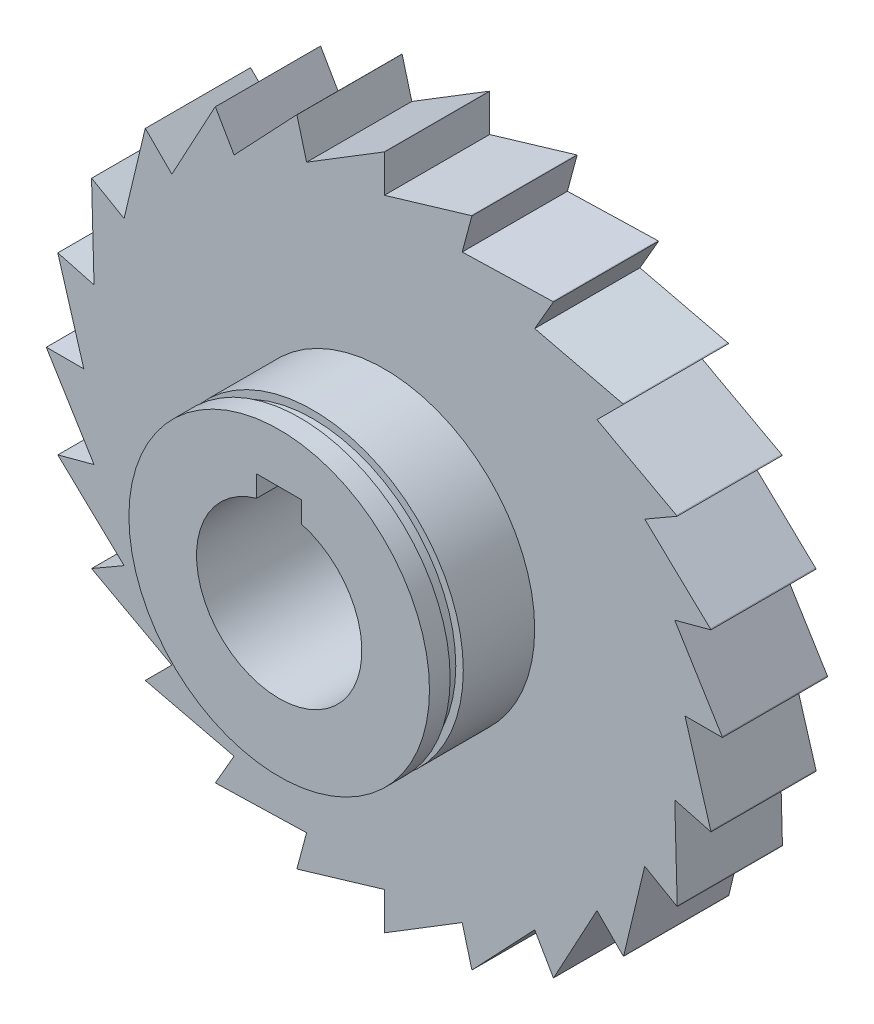
from build123d import *

# Parameters (mm, degrees)
SKETCH1_R                  = 45
BOSS_EXTRUDE1_DEPTH        = 14
SKETCH2_R                  = 20
BOSS_EXTRUDE2_DEPTH        = 14
CUT_EXTRUDE1_DEPTH         = 70.526973183
CUT_EXTRUDE1_DEPTH_BACK    = 70.526973183
SKETCH3_R                  = 11
CUT_EXTRUDE2_DEPTH         = 70.526973183
CUT_EXTRUDE2_DEPTH_BACK    = 6
SKETCH4_R                  = 30
CUT_EXTRUDE3_DEPTH         = 70.526973183
CUT_EXTRUDE3_DEPTH_BACK    = 70.526973183
SKETCH5_W                  = 6
SKETCH5_H                  = 4.8
CUT_EXTRUDE4_DEPTH         = 70.526973183
FILLET1_R                  = 0.4
CIRPATTERN1_DEPTH          = 14
CUT_J8_CIRCLIPGROOVE_START = 23.5
SKETCH_J8_GROOVE_R         = 21.5
SKETCH_J8_GROOVE_R_2       = 19
CUT_J8_CIRCLIPGROOVE_DEPTH = 1.75


# Read off the part's stored shape, not the designer's step: CirPattern1
with BuildPart() as part:
    # Sketch1 → Boss-Extrude1 (new body)
    with BuildSketch(Plane.XY):
        Circle(SKETCH1_R)
    extrude(amount=BOSS_EXTRUDE1_DEPTH)

    # Sketch2 → Boss-Extrude2 (add)
    with BuildSketch(Plane.XY.offset(14)):
        Circle(SKETCH2_R)
    extrude(amount=BOSS_EXTRUDE2_DEPTH)

    # Sketch3 → Cut-Extrude1 (cut, two sides: drawn at the far end of the back side and taken through both)
    with BuildSketch(Plane.XY.offset(28).offset(-CUT_EXTRUDE1_DEPTH_BACK)):
        Circle(SKETCH3_R)
    extrude(amount=CUT_EXTRUDE1_DEPTH + CUT_EXTRUDE1_DEPTH_BACK, mode=Mode.SUBTRACT)

    # Sketch4 → Cut-Extrude2 (cut, two sides: drawn at the far end of the back side and taken through both)
    with BuildSketch(Plane(origin=(0, 0, 0), x_dir=(-1, 0, 0), z_dir=(0, 0, -1)).offset(-CUT_EXTRUDE2_DEPTH_BACK)):
        Circle(SKETCH4_R)
    extrude(amount=CUT_EXTRUDE2_DEPTH + CUT_EXTRUDE2_DEPTH_BACK, mode=Mode.SUBTRACT)

    # Sketch5 → Cut-Extrude3 (cut, two sides: drawn at the far end of the back side and taken through both)
    with BuildSketch(Plane.XY.offset(28).offset(-CUT_EXTRUDE3_DEPTH_BACK)):
        with Locations((0, 11)):
            Rectangle(SKETCH5_W, SKETCH5_H)
    extrude(amount=CUT_EXTRUDE3_DEPTH + CUT_EXTRUDE3_DEPTH_BACK, mode=Mode.SUBTRACT)

    # Sketch6 → Cut-Extrude4 (cut, symmetric)
    with BuildSketch(Plane(origin=(0, 0, 0), x_dir=(-1, 0, 0), z_dir=(0, 0, -1))):
        with BuildLine():
            Line((0, 40), (0, 45))
            ThreePointArc((0, 45), (-5.87367865, 44.615018762), (-11.64685703, 43.466662183))
            Line((-11.64685703, 43.466662183), (0, 40))
        make_face()
    extrude(amount=CUT_EXTRUDE4_DEPTH, both=True, mode=Mode.SUBTRACT)

    # Fillet1
    fillet1_edges = [part.edges().sort_by_distance(p)[0] for p in [
        (11.64685703, 43.466662183, 7),
    ]]
    fillet(fillet1_edges, radius=FILLET1_R)

    # CirPattern1 outline → CirPattern1 (cut)
    with BuildSketch(Plane.XY):
        with BuildLine():
            Line((10.352761804, 38.637033052), (22.386673811, 38.96802613))
            ThreePointArc((22.386673811, 38.96802613), (22.43960565, 38.965973203), (22.491802074, 38.956943945))
            Line((22.491802074, 38.956943945), (20, 34.641016151))
            Line((20, 34.641016151), (31.709533711, 31.8461253))
            ThreePointArc((31.709533711, 31.8461253), (31.760130605, 31.830442556), (31.808211535, 31.808211535))
            Line((31.808211535, 31.808211535), (28.284271247, 28.284271247))
            Line((28.284271247, 28.284271247), (38.871441292, 22.553963659))
            ThreePointArc((38.871441292, 22.553963659), (38.916255145, 22.525719852), (38.956943945, 22.491802074))
            Line((38.956943945, 22.491802074), (34.641016151, 20))
            Line((34.641016151, 20), (43.384324386, 11.724786666))
            ThreePointArc((43.384324386, 11.724786666), (43.42030121, 11.685906565), (43.450825005, 11.642613471))
            Line((43.450825005, 11.642613471), (38.637033052, 10.352761804))
            Line((38.637033052, 10.352761804), (44.94063747, 0.096584839))
            ThreePointArc((44.94063747, 0.096584839), (44.965325502, 0.049718058), (44.983604147, 0))
            Line((44.983604147, 0), (40, 0))
            Line((40, 0), (43.434320378, -11.538199086))
            ThreePointArc((43.434320378, -11.538199086), (43.44603717, -11.589858654), (43.450825005, -11.642613471))
            Line((43.450825005, -11.642613471), (38.637033052, -10.352761804))
            Line((38.637033052, -10.352761804), (38.96802613, -22.386673811))
            ThreePointArc((38.96802613, -22.386673811), (38.965973203, -22.43960565), (38.956943945, -22.491802074))
            Line((38.956943945, -22.491802074), (34.641016151, -20))
            Line((34.641016151, -20), (31.8461253, -31.709533711))
            ThreePointArc((31.8461253, -31.709533711), (31.830442556, -31.760130605), (31.808211535, -31.808211535))
            Line((31.808211535, -31.808211535), (28.284271247, -28.284271247))
            Line((28.284271247, -28.284271247), (22.553963659, -38.871441292))
            ThreePointArc((22.553963659, -38.871441292), (22.525719852, -38.916255145), (22.491802074, -38.956943945))
            Line((22.491802074, -38.956943945), (20, -34.641016151))
            Line((20, -34.641016151), (11.724786666, -43.384324386))
            ThreePointArc((11.724786666, -43.384324386), (11.685906565, -43.42030121), (11.642613471, -43.450825005))
            Line((11.642613471, -43.450825005), (10.352761804, -38.637033052))
            Line((10.352761804, -38.637033052), (0.096584839, -44.94063747))
            ThreePointArc((0.096584839, -44.94063747), (0.049718058, -44.965325502), (0, -44.983604147))
            Line((0, -44.983604147), (0, -40))
            Line((0, -40), (-11.538199086, -43.434320378))
            ThreePointArc((-11.538199086, -43.434320378), (-11.589858654, -43.44603717), (-11.642613471, -43.450825005))
            Line((-11.642613471, -43.450825005), (-10.352761804, -38.637033052))
            Line((-10.352761804, -38.637033052), (-22.386673811, -38.96802613))
            ThreePointArc((-22.386673811, -38.96802613), (-22.43960565, -38.965973203), (-22.491802074, -38.956943945))
            Line((-22.491802074, -38.956943945), (-20, -34.641016151))
            Line((-20, -34.641016151), (-31.709533711, -31.8461253))
            ThreePointArc((-31.709533711, -31.8461253), (-31.760130605, -31.830442556), (-31.808211535, -31.808211535))
            Line((-31.808211535, -31.808211535), (-28.284271247, -28.284271247))
            Line((-28.284271247, -28.284271247), (-38.871441292, -22.553963659))
            ThreePointArc((-38.871441292, -22.553963659), (-38.916255145, -22.525719852), (-38.956943945, -22.491802074))
            Line((-38.956943945, -22.491802074), (-34.641016151, -20))
            Line((-34.641016151, -20), (-43.384324386, -11.724786666))
            ThreePointArc((-43.384324386, -11.724786666), (-43.42030121, -11.685906565), (-43.450825005, -11.642613471))
            Line((-43.450825005, -11.642613471), (-38.637033052, -10.352761804))
            Line((-38.637033052, -10.352761804), (-44.94063747, -0.096584839))
            ThreePointArc((-44.94063747, -0.096584839), (-44.965325502, -0.049718058), (-44.983604147, 0))
            Line((-44.983604147, 0), (-40, 0))
            Line((-40, 0), (-43.434320378, 11.538199086))
            ThreePointArc((-43.434320378, 11.538199086), (-43.44603717, 11.589858654), (-43.450825005, 11.642613471))
            Line((-43.450825005, 11.642613471), (-38.637033052, 10.352761804))
            Line((-38.637033052, 10.352761804), (-38.96802613, 22.386673811))
            ThreePointArc((-38.96802613, 22.386673811), (-38.965973203, 22.43960565), (-38.956943945, 22.491802074))
            Line((-38.956943945, 22.491802074), (-34.641016151, 20))
            Line((-34.641016151, 20), (-31.8461253, 31.709533711))
            ThreePointArc((-31.8461253, 31.709533711), (-31.830442556, 31.760130605), (-31.808211535, 31.808211535))
            Line((-31.808211535, 31.808211535), (-28.284271247, 28.284271247))
            Line((-28.284271247, 28.284271247), (-22.553963659, 38.871441292))
            ThreePointArc((-22.553963659, 38.871441292), (-22.525719852, 38.916255145), (-22.491802074, 38.956943945))
            Line((-22.491802074, 38.956943945), (-20, 34.641016151))
            Line((-20, 34.641016151), (-11.724786666, 43.384324386))
            ThreePointArc((-11.724786666, 43.384324386), (-11.685906565, 43.42030121), (-11.642613471, 43.450825005))
            Line((-11.642613471, 43.450825005), (-10.352761804, 38.637033052))
            Line((-10.352761804, 38.637033052), (-0.096584839, 44.94063747))
            ThreePointArc((-0.096584839, 44.94063747), (-0.049718058, 44.965325502), (0, 44.983604147))
            Line((0, 44.983604147), (0, 45))
            ThreePointArc((0, 45), (-5.930124979, -44.607551129), (11.756815703, 43.437049676))
            ThreePointArc((11.756815703, 43.437049676), (11.700212353, 43.448063996), (11.642613471, 43.450825005))
            Line((11.642613471, 43.450825005), (10.352761804, 38.637033052))
        make_face()
    extrude(amount=CIRPATTERN1_DEPTH, mode=Mode.SUBTRACT)

    # Sketch_J8_Groove → Cut_J8_CirclipGroove (cut)
    with BuildSketch(Plane.XY.offset(CUT_J8_CIRCLIPGROOVE_START)):
        Circle(SKETCH_J8_GROOVE_R)
        Circle(SKETCH_J8_GROOVE_R_2, mode=Mode.SUBTRACT)
    extrude(amount=CUT_J8_CIRCLIPGROOVE_DEPTH, mode=Mode.SUBTRACT)


solid = part.part
